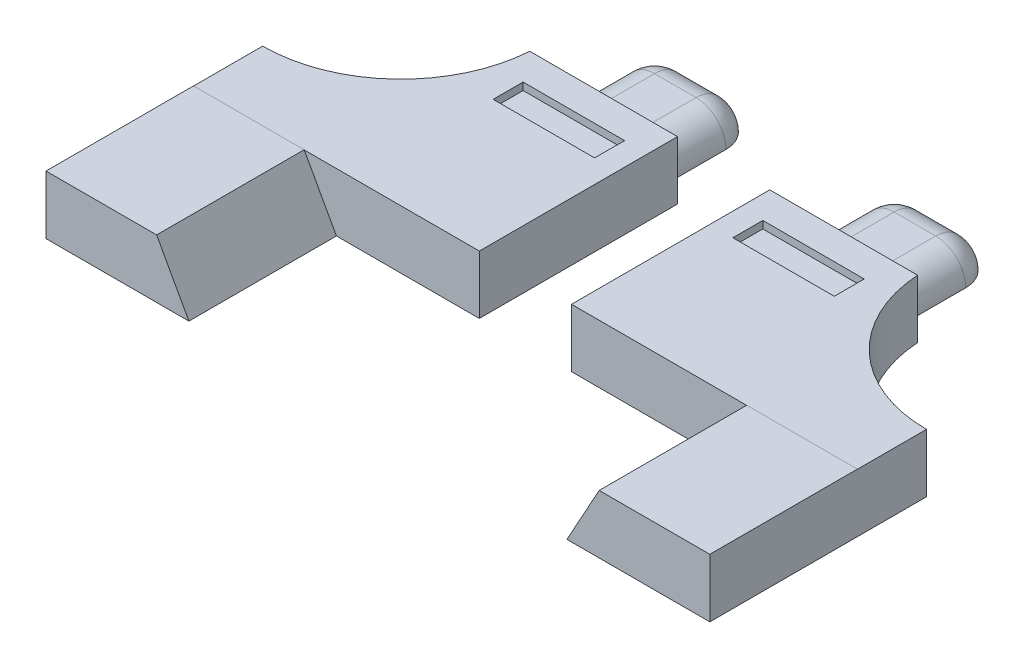
from build123d import *

# Parameters (mm, degrees)
EXTRUDE_1_DEPTH     = 32
SKETCH_2_W          = 62
SKETCH_2_H          = 12.670241622
EXTRUDE_2_DEPTH     = 43
SKETCH_3_R          = 30
CUT_EXTRUDE_1_DEPTH = 99.130194246
SKETCH_4_W          = 22
SKETCH_4_H          = 6.5
EXTRUDE_3_DEPTH     = 22
FILLET_1_R          = 6.5
SKETCH_5_W          = 22
SKETCH_5_H          = 6.5
CUT_EXTRUDE_2_DEPTH = 1.6


with BuildPart() as part:
    # Эскиз1 → Бобышка-Вытянуть1 (new body)
    with BuildSketch(Plane.XY):
        Polygon((0, 0), (0, 12.7), (24, 12.7), (31, 0), align=None)
    extrude(amount=-EXTRUDE_1_DEPTH)

    # Эскиз2 → Бобышка-Вытянуть2 (add)
    with BuildSketch(Plane(origin=(0, 0, -32), x_dir=(-1, 0, 0), z_dir=(0, 0, -1))):
        with Locations((-31, 6.335120811)):
            Rectangle(SKETCH_2_W, SKETCH_2_H)
    extrude(amount=EXTRUDE_2_DEPTH)

    # Эскиз3 → Вырез-Вытянуть1 (cut, through all)
    with BuildSketch(Plane(origin=(0, 12.670241622, 0), x_dir=(1, 0, 0), z_dir=(0, 1, 0))):
        with Locations((0, 77)):
            Circle(SKETCH_3_R)
    extrude(amount=-CUT_EXTRUDE_1_DEPTH, mode=Mode.SUBTRACT)

    # Эскиз4 → Бобышка-Вытянуть3 (add)
    with BuildSketch(Plane(origin=(0, 0, -75), x_dir=(-1, 0, 0), z_dir=(0, 0, -1))):
        with Locations((-46, 3.25)):
            Rectangle(SKETCH_4_W, SKETCH_4_H)
    extrude(amount=EXTRUDE_3_DEPTH)

    # Скругление1
    # the kernel refuses this fillet: 6.5 mm, written as the material it adds along each edge
    # the kernel refuses this fillet: 6.5 mm, written as the material it takes off along each edge
    with BuildSketch(Plane(origin=(50.5, 0, -90.5), x_dir=(0, 1, 0), z_dir=(1, 0, 0))) as fillet_1_2_piece_1_section:
        Polygon((0, 0), (FILLET_1_R * 1.02, 0), (FILLET_1_R * 1.02, -FILLET_1_R * 1.02), (0, -FILLET_1_R * 1.02), align=None)
    fillet_1_2_piece_1 = extrude(amount=FILLET_1_R * 1.02, mode=Mode.PRIVATE)
    fillet_1_2_piece_1 = fillet_1_2_piece_1 - Plane(origin=(50.5, 0, -90.5), x_dir=(0, -0.7071067811865475, 0.7071067811865475), z_dir=(1, 0, 0)) * Sphere(FILLET_1_R, mode=Mode.PRIVATE)
    add(fillet_1_2_piece_1, mode=Mode.SUBTRACT)
    with BuildSketch(Plane(origin=(41.5, 0, -90.5), x_dir=(-1, 0, 0), z_dir=(0, 1, 0))) as fillet_1_2_piece_2_section:
        Polygon((0, 0), (FILLET_1_R * 1.02, 0), (FILLET_1_R * 1.02, -FILLET_1_R * 1.02), (0, -FILLET_1_R * 1.02), align=None)
    fillet_1_2_piece_2 = extrude(amount=FILLET_1_R * 1.02, mode=Mode.PRIVATE)
    fillet_1_2_piece_2 = fillet_1_2_piece_2 - Plane(origin=(41.5, 0, -90.5), x_dir=(0.7071067811865475, 0, 0.7071067811865475), z_dir=(0, 1, 0)) * Sphere(FILLET_1_R, mode=Mode.PRIVATE)
    add(fillet_1_2_piece_2, mode=Mode.SUBTRACT)
    with BuildSketch(Plane(origin=(57, 6.5, -75), x_dir=(0, -1, 0), z_dir=(0, 0, -1)), Plane(origin=(35, 6.5, -75), x_dir=(1, 0, 0), z_dir=(0, 0, -1))) as fillet_1_2_piece_3:
        with BuildLine():
            CenterArc((FILLET_1_R, FILLET_1_R), FILLET_1_R, 180, 90)
            Line((0, FILLET_1_R), (0, 0))
            Line((0, 0), (FILLET_1_R, 0))
        make_face()
    extrude(amount=15.5, mode=Mode.SUBTRACT)
    with BuildSketch(Plane(origin=(41.5, 6.5, -97), x_dir=(0, 0, 1), z_dir=(1, 0, 0))) as fillet_1_2_piece_4:
        with BuildLine():
            CenterArc((FILLET_1_R, FILLET_1_R), FILLET_1_R, 180, 90)
            Line((0, FILLET_1_R), (0, 0))
            Line((0, 0), (FILLET_1_R, 0))
        make_face()
    extrude(amount=9, mode=Mode.SUBTRACT)

    # Эскиз5 → Вырез-Вытянуть2 (cut)
    with BuildSketch(Plane(origin=(0, 12.670241622, 0), x_dir=(1, 0, 0), z_dir=(0, 1, 0))):
        with Locations((46, 65.25)):
            Rectangle(SKETCH_5_W, SKETCH_5_H)
    extrude(amount=-CUT_EXTRUDE_2_DEPTH, mode=Mode.SUBTRACT)


with BuildPart() as body_2:
    # Зеркальное отражение1: mirrored copy
    add(part.part.mirror(Plane(origin=(72, 0, 0), x_dir=(0, 0, 1), z_dir=(1, 0, 0))))


solid = Compound([part.part, body_2.part])
